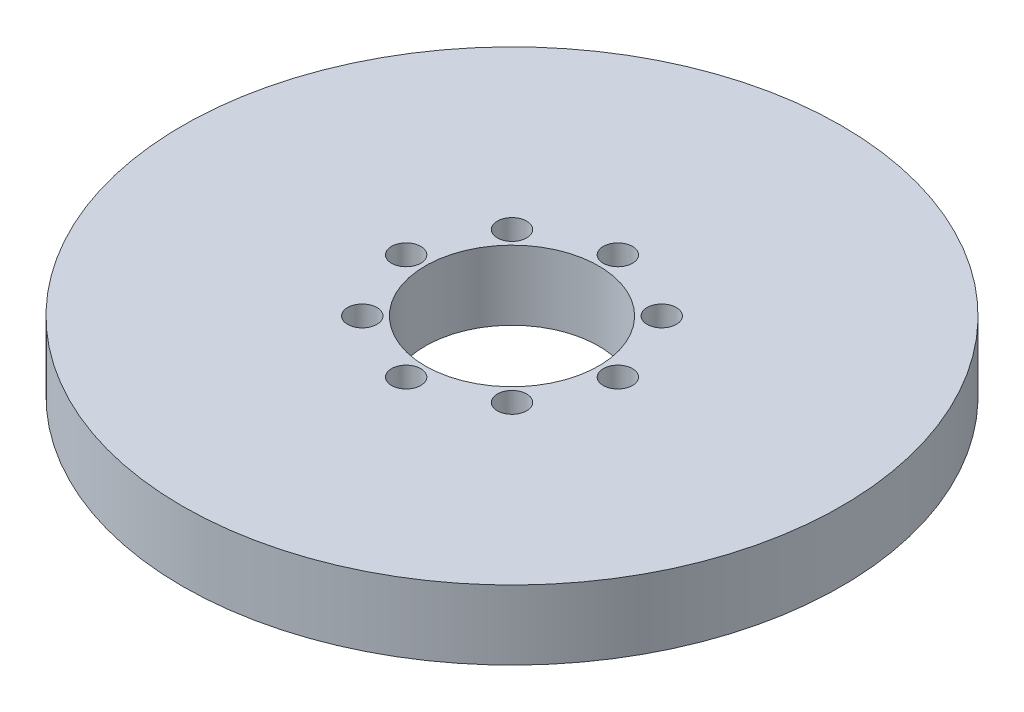
from build123d import *

# Parameters (mm, degrees)
SKETCH1_R           = 47.5
BOSS_EXTRUDE1_DEPTH = 10
SKETCH2_R           = 12.5
CUT_EXTRUDE1_DEPTH  = 68.915388536
SKETCH3_R           = 2.110030692
CUT_EXTRUDE2_DEPTH  = 7.175651543
CIRPATTERN1_COUNT   = 8


with BuildPart() as part:
    # Sketch1 → Boss-Extrude1 (new body)
    with BuildSketch(Plane(origin=(0, 0, 0), x_dir=(1, 0, 0), z_dir=(0, 1, 0))):
        Circle(SKETCH1_R)
    extrude(amount=BOSS_EXTRUDE1_DEPTH)

    # Sketch2 → Cut-Extrude1 (cut, through all)
    with BuildSketch(Plane(origin=(0, 0, 0), x_dir=(1, 0, 0), z_dir=(0, 1, 0))):
        Circle(SKETCH2_R)
    extrude(amount=CUT_EXTRUDE1_DEPTH, mode=Mode.SUBTRACT)

    # Sketch3 → Cut-Extrude2 (cut)
    with BuildSketch(Plane(origin=(0, 10, 0), x_dir=(1, 0, 0), z_dir=(0, 1, 0))):
        with Locations((-15.259669359, 0)):
            Circle(SKETCH3_R)
    cut_extrude2 = extrude(amount=-CUT_EXTRUDE2_DEPTH, mode=Mode.SUBTRACT)

    # CirPattern1: Cut-Extrude2 ×8 about axis
    cirpattern1_axis = Axis((0, 0, 0), (0, 1, 0))
    for i in range(1, CIRPATTERN1_COUNT):
        add(cut_extrude2.rotate(cirpattern1_axis, i * 360 / CIRPATTERN1_COUNT), mode=Mode.SUBTRACT)


solid = part.part
